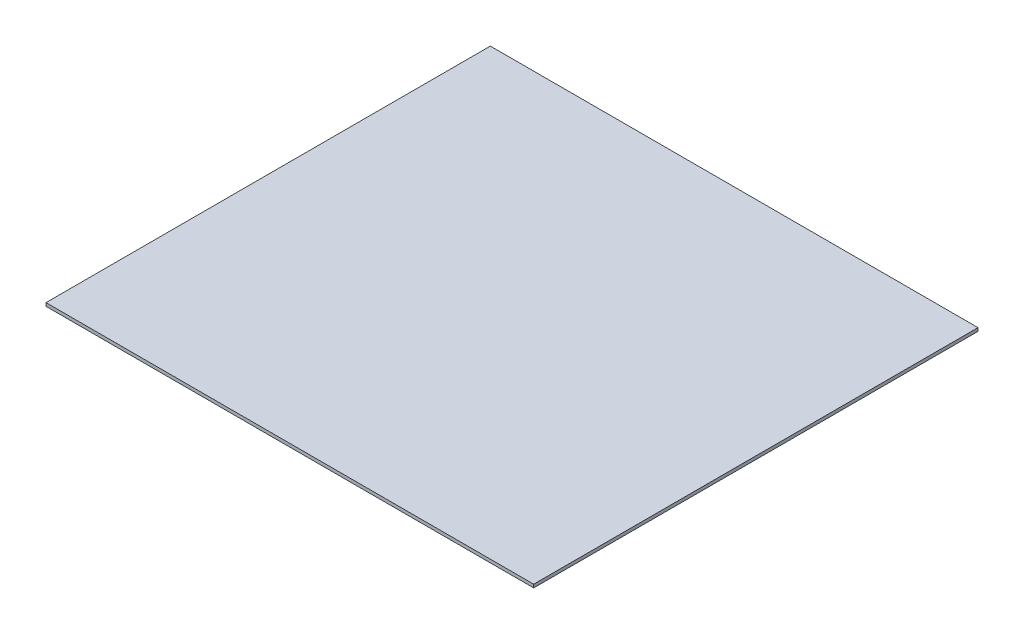
from build123d import *

# Parameters (mm, degrees)
SKETCH1_W           = 450
SKETCH1_H           = 410
BOSS_EXTRUDE1_DEPTH = 1.5


with BuildPart() as part:
    # Sketch1 → Boss-Extrude1 (new, symmetric)
    with BuildSketch(Plane(origin=(0, 0, 0), x_dir=(1, 0, 0), z_dir=(0, 1, 0))):
        Rectangle(SKETCH1_W, SKETCH1_H)
    extrude(amount=BOSS_EXTRUDE1_DEPTH, both=True)


solid = part.part
